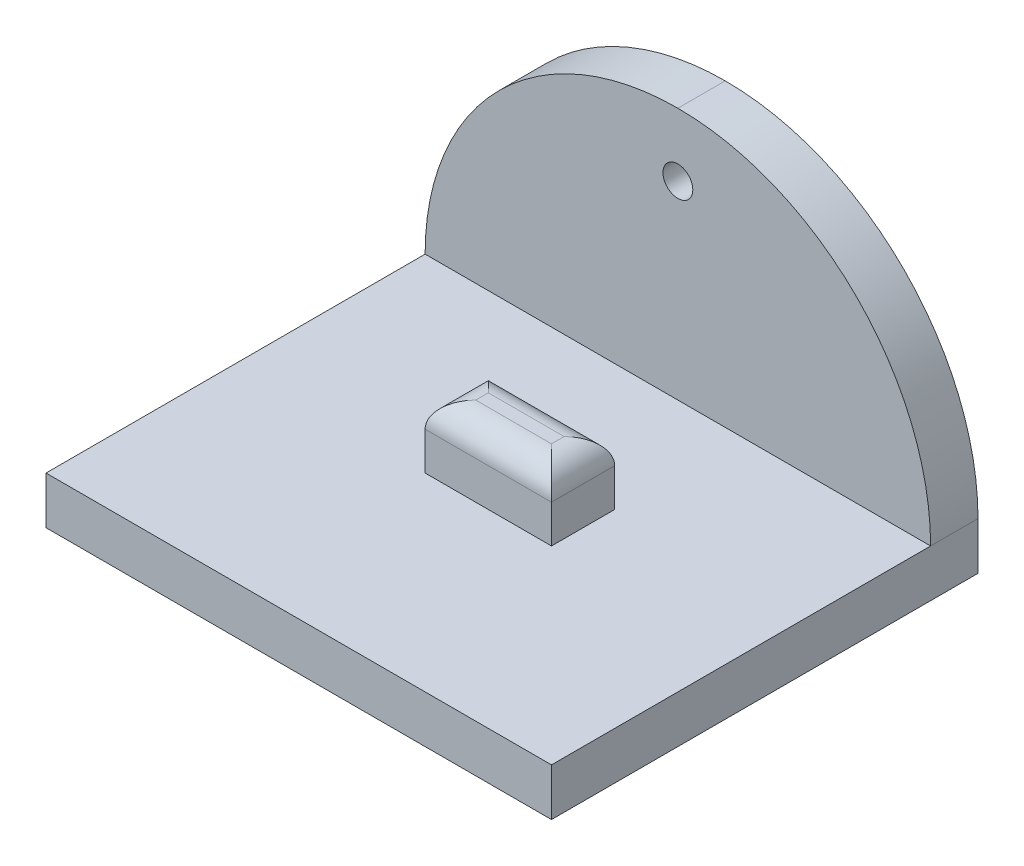
from build123d import *

# Parameters (mm, degrees)
BOSS_EXTRUDE1_DEPTH = 50.8
SKETCH2_W           = 12.7
SKETCH2_H           = 6.35
BOSS_EXTRUDE2_DEPTH = 6.35
SKETCH3_R           = 1.499997
CUT_EXTRUDE1_DEPTH  = 71.299547696
FILLET1_R           = 2.54
FILLET2_R           = 25.4


with BuildPart() as part:
    # Sketch1 → Boss-Extrude1 (new body)
    with BuildSketch(Plane(origin=(0, 0, 0), x_dir=(0, 0, -1), z_dir=(1, 0, 0))):
        Polygon((0, 0), (-42.8625, 0), (-42.8625, 4.7625), (-4.7625, 4.7625), (-4.7625, 30.1625), (0, 30.1625), align=None)
    extrude(amount=BOSS_EXTRUDE1_DEPTH)

    # Sketch2 → Boss-Extrude2 (add)
    with BuildSketch(Plane(origin=(0, 4.7625, 0), x_dir=(1, 0, 0), z_dir=(0, 1, 0))):
        with Locations((25.4, -20.6375)):
            Rectangle(SKETCH2_W, SKETCH2_H)
    extrude(amount=BOSS_EXTRUDE2_DEPTH)

    # Sketch3 → Cut-Extrude1 (cut, through all)
    with BuildSketch(Plane.XY.offset(4.7625)):
        with Locations((25.4, 23.8125)):
            Circle(SKETCH3_R)
    extrude(amount=-CUT_EXTRUDE1_DEPTH, mode=Mode.SUBTRACT)

    # Fillet1
    fillet1_edges = [part.edges().sort_by_distance(p)[0] for p in [
        (19.05, 11.1125, 20.6375),
        (25.4, 11.1125, 23.8125),
        (31.75, 11.1125, 20.6375),
        (25.4, 11.1125, 17.4625),
    ]]
    fillet(fillet1_edges, radius=FILLET1_R)

    # Fillet2
    fillet2_edges = [part.edges().sort_by_distance(p)[0] for p in [
        (50.8, 30.1625, 2.38125),
        (0, 30.1625, 2.38125),
    ]]
    fillet(fillet2_edges, radius=FILLET2_R - 0.0001)  # a hair under: the kernel refuses the full size


solid = part.part
